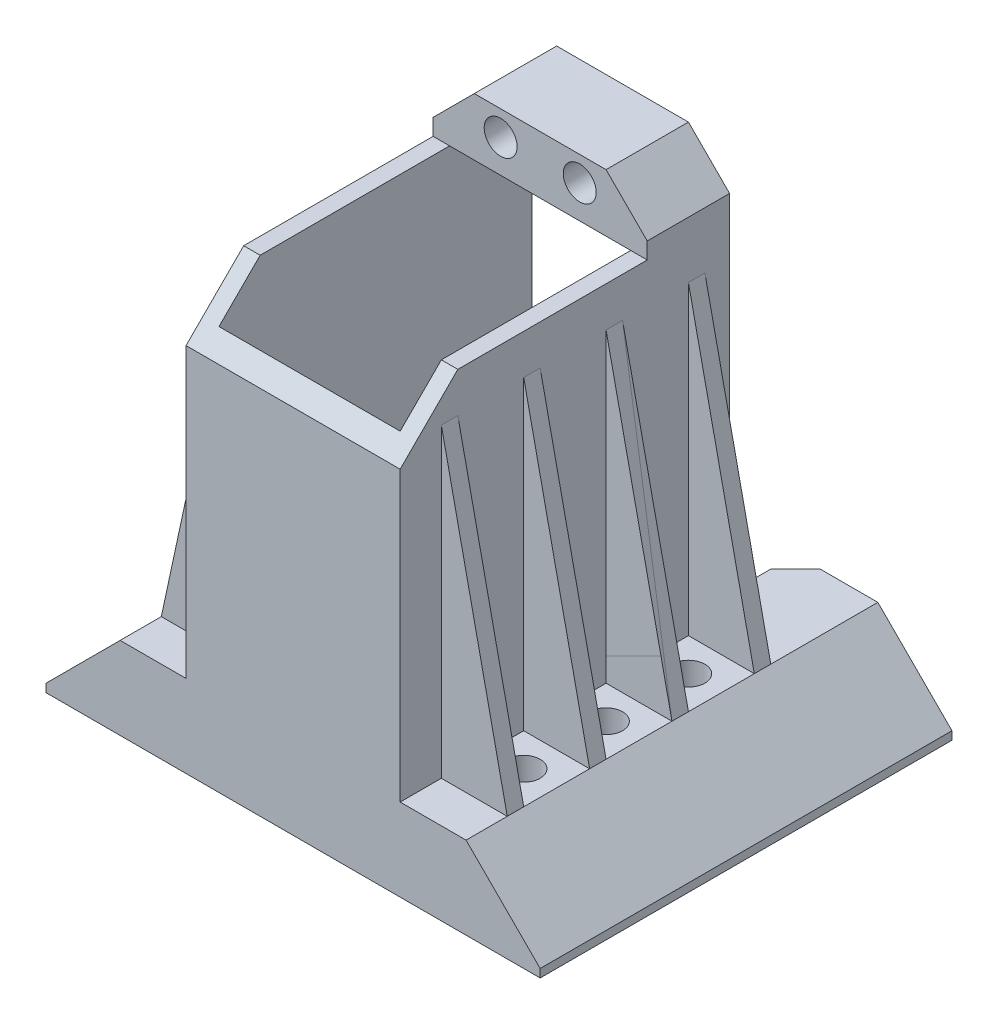
from build123d import *

# Parameters (mm, degrees)
SKETCH1_W                 = 60
SKETCH1_H                 = 50
BOSS_EXTRUDE1_DEPTH       = 10
CHAMFER1_SIZE             = 9
SKETCH2_W                 = 22
SKETCH2_H                 = 20
CUT_EXTRUDE1_DEPTH        = 41.311288741
CHAMFER2_SIZE             = 3
SKETCH3_R                 = 2
CUT_EXTRUDE2_DEPTH        = 10
BOSS_EXTRUDE2_DEPTH       = 42
BOSS_EXTRUDE3_DEPTH       = 2
BOSS_EXTRUDE3_2_DEPTH     = 2
LPATTERN1_START           = 8
LPATTERN1_DEPTH           = 2
LPATTERN1_2_DEPTH         = 2
LPATTERN1_START_2         = 18
LPATTERN1_3_DEPTH         = 2
LPATTERN1_4_DEPTH         = 2
LPATTERN1_5_DEPTH         = 2
LPATTERN1_6_DEPTH         = 2
LPATTERN1_START_3         = -12
LPATTERN1_7_DEPTH         = 2
LPATTERN1_8_DEPTH         = 2
LPATTERN1_START_4         = -2
LPATTERN1_9_DEPTH         = 2
LPATTERN1_10_DEPTH        = 2
SKETCH6_W                 = 26
SKETCH6_H                 = 10
BOSS_EXTRUDE4_DEPTH       = 7
CHAMFER5_SIZE             = 7
SKETCH10_R                = 2
CUT_EXTRUDE4_DEPTH        = 78.336925204
CHAMFER6_SIZE             = 5
SKETCH11_R                = 2
CUT_EXTRUDE5_DEPTH        = 63.657800791
LPATTERN2_COUNT           = 3
LPATTERN2_PITCH           = 10
LPATTERN2_COPY_1_SKETCH_R = 2
LPATTERN2_COPY_1_DEPTH    = 63.657800791
LPATTERN2_COPY_2_SKETCH_R = 2
LPATTERN2_COPY_2_DEPTH    = 63.657800791


# Read off the part's stored shape, not the designer's step: LPattern1
with BuildPart() as part:
    # Sketch1 → Boss-Extrude1 (new body)
    with BuildSketch(Plane(origin=(0, 0, 0), x_dir=(1, 0, 0), z_dir=(0, 1, 0))):
        Rectangle(SKETCH1_W, SKETCH1_H)
    extrude(amount=BOSS_EXTRUDE1_DEPTH)

    # Chamfer1
    chamfer1_edges = [part.edges().sort_by_distance(p)[0] for p in [
        (-30, 10, 0),
        (30, 10, 0),
    ]]
    chamfer(chamfer1_edges, length=CHAMFER1_SIZE)

    # Sketch2 → Cut-Extrude1 (cut, through all)
    with BuildSketch(Plane(origin=(0, 10, 0), x_dir=(1, 0, 0), z_dir=(0, 1, 0))):
        with Locations((0, 25)):
            Rectangle(SKETCH2_W, SKETCH2_H)
    extrude(amount=-CUT_EXTRUDE1_DEPTH, mode=Mode.SUBTRACT)

    # Chamfer2
    chamfer2_edges = [part.edges().sort_by_distance(p)[0] for p in [
        (11, 5, -25),
        (-11, 5, -25),
    ]]
    chamfer(chamfer2_edges, length=CHAMFER2_SIZE)

    # Sketch3 → Cut-Extrude2 (cut)
    with BuildSketch(Plane(origin=(0, 0, -15), x_dir=(-1, 0, 0), z_dir=(0, 0, -1))):
        with Locations((-4.8, 5)):
            Circle(SKETCH3_R)
        with Locations((4.8, 5)):
            Circle(SKETCH3_R)
    extrude(amount=-CUT_EXTRUDE2_DEPTH, mode=Mode.SUBTRACT)

    # Sketch4 → Boss-Extrude2 (add)
    with BuildSketch(Plane(origin=(0, 10, 0), x_dir=(1, 0, 0), z_dir=(0, 1, 0))):
        Polygon((-11, 15), (-13, 15), (-13, -25), (-11, -25), (11, -25), (13, -25), (13, 15), (11, 15), (11, -23), (-11, -23), align=None)
    extrude(amount=BOSS_EXTRUDE2_DEPTH)

    # Sketch6 → Boss-Extrude4 (add)
    with BuildSketch(Plane(origin=(0, 52, 0), x_dir=(1, 0, 0), z_dir=(0, 1, 0))):
        with Locations((0, 10)):
            Rectangle(SKETCH6_W, SKETCH6_H)
    extrude(amount=BOSS_EXTRUDE4_DEPTH)

    # Chamfer5
    # the kernel refuses this chamfer: 7 mm, written as the material it takes off along each edge
    with BuildSketch(Plane(origin=(31.001780916, 52, 25), x_dir=(0, -0.9996219169112968, 0.02749587661058662), z_dir=(-1, 0, 0))) as chamfer5_piece_1:
        Polygon((CHAMFER5_SIZE * 0.999621916911, -CHAMFER5_SIZE * 0.0274958766106), (-CHAMFER5_SIZE * 0.0274958766106, -CHAMFER5_SIZE * 0.999621916911), (0, 0), align=None)
    extrude(amount=62.003561832, mode=Mode.SUBTRACT)

    # Sketch10 → Cut-Extrude4 (cut, through all)
    with BuildSketch(Plane(origin=(0, 0, -15), x_dir=(-1, 0, 0), z_dir=(0, 0, -1))):
        with Locations((-4.8, 56)):
            Circle(SKETCH10_R)
        with Locations((4.8, 56)):
            Circle(SKETCH10_R)
    extrude(amount=-CUT_EXTRUDE4_DEPTH, mode=Mode.SUBTRACT)

    # Chamfer6
    chamfer6_edges = [part.edges().sort_by_distance(p)[0] for p in [
        (-13, 59, -10),
        (13, 59, -10),
    ]]
    chamfer(chamfer6_edges, length=CHAMFER6_SIZE)

    # Sketch11 → Cut-Extrude5 (cut, through all)
    with BuildSketch(Plane(origin=(0, 10, 0), x_dir=(1, 0, 0), z_dir=(0, 1, 0))):
        with Locations(Location((-17, -14, 0), (0, 0, 270))):
            Circle(SKETCH11_R)
    cut_extrude5 = extrude(amount=-CUT_EXTRUDE5_DEPTH, mode=Mode.SUBTRACT)

    # Mirror4: Cut-Extrude5 across plane
    add(cut_extrude5.mirror(Plane(origin=(0, 0, 0), x_dir=(0, 0, 1), z_dir=(1, 0, 0))), mode=Mode.SUBTRACT)

    # LPattern2: Cut-Extrude5 ×3
    with Locations(*[(0, 0, -i * LPATTERN2_PITCH) for i in range(1, LPATTERN2_COUNT)]):
        add(cut_extrude5, mode=Mode.SUBTRACT)

    # LPattern2 copy 1 sketch → LPattern2 copy 1 (cut, through all)
    with BuildSketch(Plane(origin=(0, 10, -10), x_dir=(-1, 0, 0), z_dir=(0, 1, 0))):
        with Locations((-17, 14)):
            Circle(LPATTERN2_COPY_1_SKETCH_R)
    extrude(amount=-LPATTERN2_COPY_1_DEPTH, mode=Mode.SUBTRACT)

    # LPattern2 copy 2 sketch → LPattern2 copy 2 (cut, through all)
    with BuildSketch(Plane(origin=(0, 10, -20), x_dir=(-1, 0, 0), z_dir=(0, 1, 0))):
        with Locations((-17, 14)):
            Circle(LPATTERN2_COPY_2_SKETCH_R)
    extrude(amount=-LPATTERN2_COPY_2_DEPTH, mode=Mode.SUBTRACT)


with BuildPart() as body_2:
    # Sketch5 → Boss-Extrude3 (new body)
    with BuildSketch(Plane.XY):
        Polygon((21, 10), (13, 10), (13, 47.139248054), align=None)
    extrude(amount=-BOSS_EXTRUDE3_DEPTH)


with BuildPart() as body_3:
    # Sketch5 → Boss-Extrude3 2 (new body)
    with BuildSketch(Plane.XY):
        Polygon((-21, 10), (-13, 10), (-13, 47.139248054), align=None)
    extrude(amount=-BOSS_EXTRUDE3_2_DEPTH)


with BuildPart() as body_4:
    # LPattern1 outline → LPattern1 (new body)
    with BuildSketch(Plane.XY.offset(LPATTERN1_START)):
        Polygon((-13, 10), (-13, 47.139248054), (-21, 10), align=None)
    extrude(amount=LPATTERN1_DEPTH)


with BuildPart() as body_5:
    # LPattern1 2 outline → LPattern1 2 (new body)
    with BuildSketch(Plane.XY.offset(LPATTERN1_START)):
        Polygon((13, 10), (21, 10), (13, 47.139248054), align=None)
    extrude(amount=LPATTERN1_2_DEPTH)


with BuildPart() as body_6:
    # LPattern1 3 outline → LPattern1 3 (new body)
    with BuildSketch(Plane.XY.offset(LPATTERN1_START_2)):
        Polygon((-13, 10), (-13, 47.139248054), (-21, 10), align=None)
    extrude(amount=LPATTERN1_3_DEPTH)


with BuildPart() as body_7:
    # LPattern1 4 outline → LPattern1 4 (new body)
    with BuildSketch(Plane.XY.offset(LPATTERN1_START_2)):
        Polygon((13, 10), (21, 10), (13, 47.139248054), align=None)
    extrude(amount=LPATTERN1_4_DEPTH)


with BuildPart() as body_8:
    # LPattern1 5 outline → LPattern1 5 (new body)
    with BuildSketch(Plane.XY.offset(LPATTERN1_START)):
        Polygon((-13, 10), (-13, 47.139248054), (-21, 10), align=None)
    extrude(amount=LPATTERN1_5_DEPTH)


with BuildPart() as body_9:
    # LPattern1 6 outline → LPattern1 6 (new body)
    with BuildSketch(Plane.XY.offset(LPATTERN1_START)):
        Polygon((13, 10), (21, 10), (13, 47.139248054), align=None)
    extrude(amount=LPATTERN1_6_DEPTH)


with BuildPart() as body_10:
    # LPattern1 7 outline → LPattern1 7 (new body)
    with BuildSketch(Plane.XY.offset(LPATTERN1_START_3)):
        Polygon((-13, 10), (-13, 47.139248054), (-21, 10), align=None)
    extrude(amount=LPATTERN1_7_DEPTH)


with BuildPart() as body_11:
    # LPattern1 8 outline → LPattern1 8 (new body)
    with BuildSketch(Plane.XY.offset(LPATTERN1_START_3)):
        Polygon((13, 10), (21, 10), (13, 47.139248054), align=None)
    extrude(amount=LPATTERN1_8_DEPTH)


with BuildPart() as body_12:
    # LPattern1 9 outline → LPattern1 9 (new body)
    with BuildSketch(Plane.XY.offset(LPATTERN1_START_4)):
        Polygon((-13, 10), (-13, 47.139248054), (-21, 10), align=None)
    extrude(amount=LPATTERN1_9_DEPTH)


with BuildPart() as body_13:
    # LPattern1 10 outline → LPattern1 10 (new body)
    with BuildSketch(Plane.XY.offset(LPATTERN1_START_4)):
        Polygon((13, 10), (21, 10), (13, 47.139248054), align=None)
    extrude(amount=LPATTERN1_10_DEPTH)


solid = Compound([part.part, body_2.part, body_3.part, body_4.part, body_5.part, body_6.part, body_7.part, body_8.part, body_9.part, body_10.part, body_11.part, body_12.part, body_13.part])
